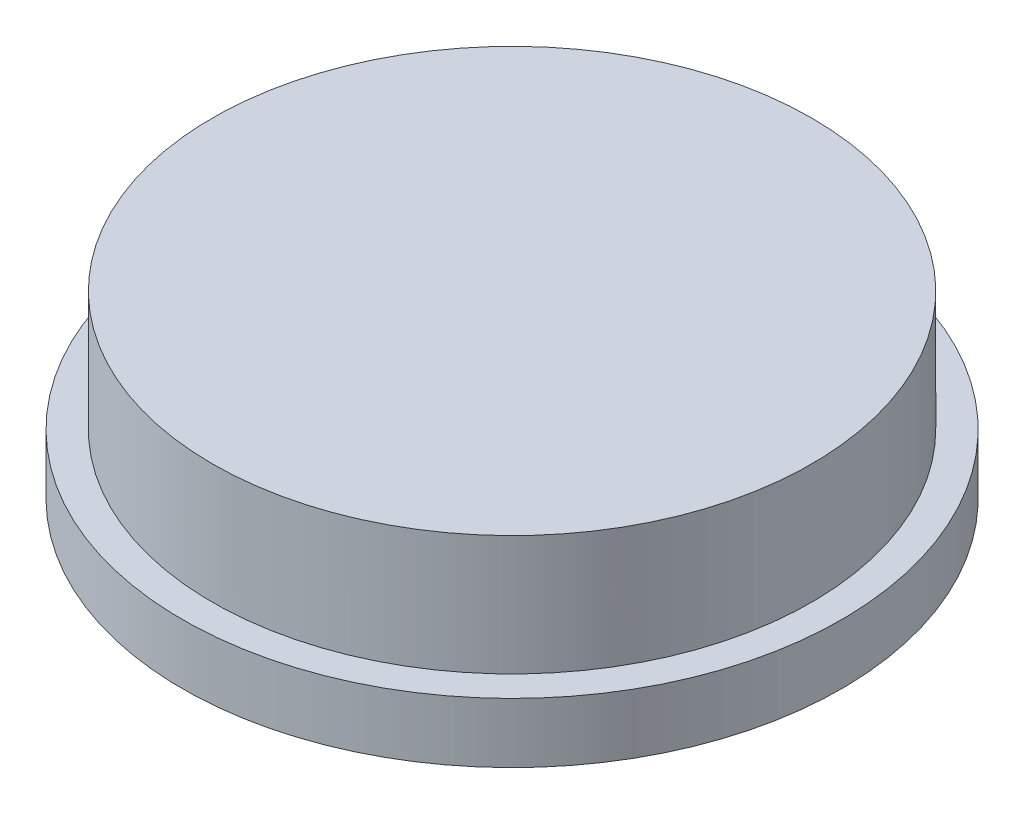
from build123d import *

# Parameters (mm, degrees)
SKETCH1_R           = 10
BOSS_EXTRUDE1_DEPTH = 6
SKETCH4_R           = 11
BOSS_EXTRUDE2_DEPTH = 2
CUT_EXTRUDE2_DEPTH  = 5


with BuildPart() as part:
    # Sketch1 → Boss-Extrude1 (new body)
    with BuildSketch(Plane(origin=(0, 0, 0), x_dir=(1, 0, 0), z_dir=(0, 1, 0))):
        Circle(SKETCH1_R)
    extrude(amount=BOSS_EXTRUDE1_DEPTH)

    # Sketch4 → Boss-Extrude2 (add)
    with BuildSketch(Plane.XZ):
        Circle(SKETCH4_R)
    extrude(amount=-BOSS_EXTRUDE2_DEPTH)

    # Sketch3 → Cut-Extrude2 (cut)
    with BuildSketch(Plane(origin=(0, 0, 0), x_dir=(1, 0, 0), z_dir=(0, 1, 0))):
        Polygon((3.031088913, 0), (1.515544457, 2.625), (-1.515544457, 2.625), (-3.031088913, 0), (-1.515544457, -2.625), (1.515544457, -2.625), align=None)
    extrude(amount=CUT_EXTRUDE2_DEPTH, mode=Mode.SUBTRACT)


solid = part.part
